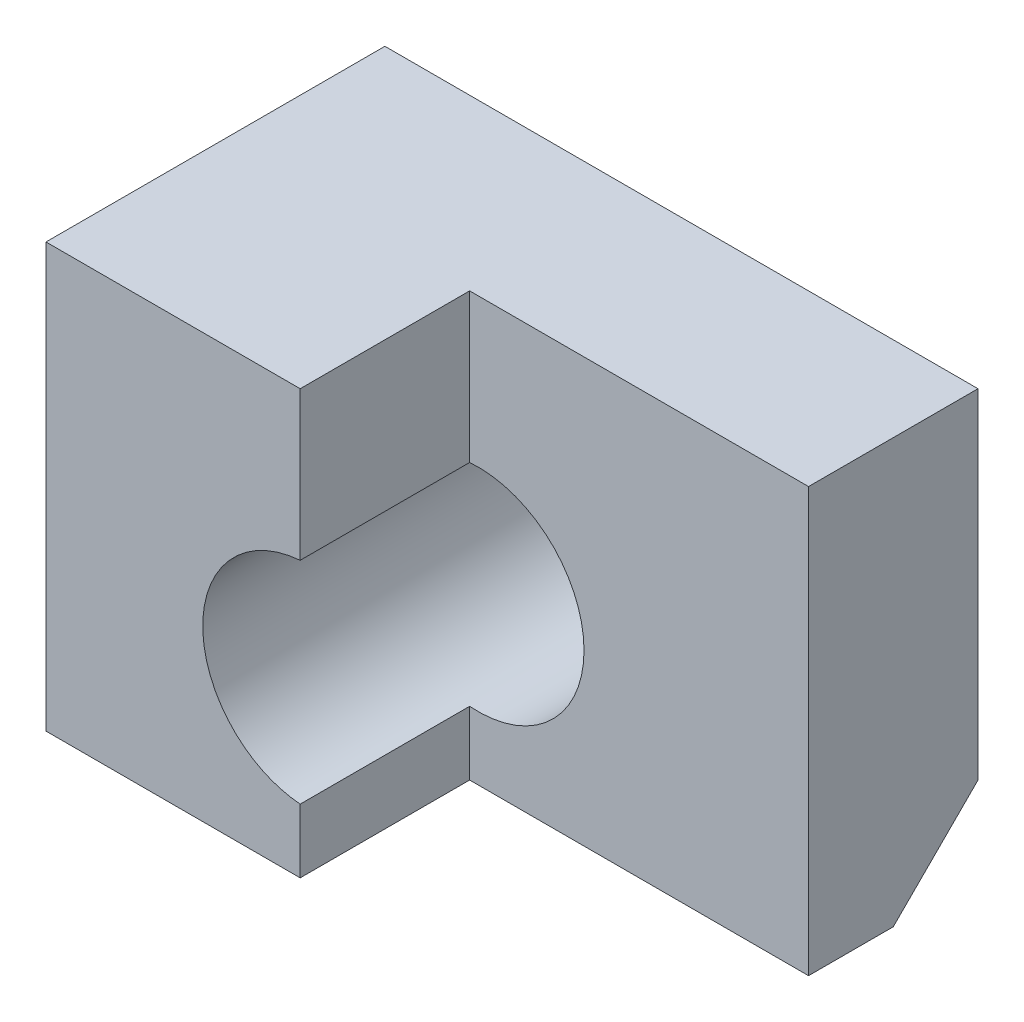
from build123d import *

# Parameters (mm, degrees)
SKETCH1_W                 = 7
SKETCH1_H                 = 5
BOSS_EXTRUDE1_DEPTH       = 4
M3X0_5_TAPPED_HOLE1_D     = 2.5
M3X0_5_TAPPED_HOLE1_DEPTH = 8.5
M3X0_5_TAPPED_HOLE1_TIP   = 0.751075774
SKETCH6_W                 = 4
SKETCH6_H                 = 5
CUT_EXTRUDE1_DEPTH        = 2
CHAMFER1_SIZE             = 1


with BuildPart() as part:
    # Sketch1 → Boss-Extrude1 (new body)
    with BuildSketch(Plane.XY):
        with Locations((3.5, 2.5)):
            Rectangle(SKETCH1_W, SKETCH1_H)
    extrude(amount=BOSS_EXTRUDE1_DEPTH)

    # M3x0.5 Tapped Hole1
    with Locations(Plane(origin=(0, 0, 0), x_dir=(-1, 0, 0), z_dir=(0, 0, -1))):
        with Locations((-3.1, 2)):
            Hole(M3X0_5_TAPPED_HOLE1_D / 2, depth=M3X0_5_TAPPED_HOLE1_DEPTH)
            with Locations((0, 0, -(M3X0_5_TAPPED_HOLE1_DEPTH + M3X0_5_TAPPED_HOLE1_TIP / 2))):  # 118° drill point
                Cone(0, M3X0_5_TAPPED_HOLE1_D / 2, M3X0_5_TAPPED_HOLE1_TIP, mode=Mode.SUBTRACT)

    # Sketch6 → Cut-Extrude1 (cut)
    with BuildSketch(Plane.XY.offset(4)):
        with Locations((5, 2.5)):
            Rectangle(SKETCH6_W, SKETCH6_H)
    extrude(amount=-CUT_EXTRUDE1_DEPTH, mode=Mode.SUBTRACT)

    # Chamfer1
    # the kernel refuses this chamfer: 1 mm, written as the material it takes off along each edge
    with BuildSketch(Plane(origin=(-2.571682988, 0, 0), x_dir=(0, -0.027495876610586372, 0.9996219169112968), z_dir=(1, 0, 0))) as chamfer1_piece_1:
        Polygon((CHAMFER1_SIZE * 0.999621916911, -CHAMFER1_SIZE * 0.0274958766106), (-CHAMFER1_SIZE * 0.0274958766106, -CHAMFER1_SIZE * 0.999621916911), (0, 0), align=None)
    extrude(amount=12.143365976, mode=Mode.SUBTRACT)


solid = part.part
